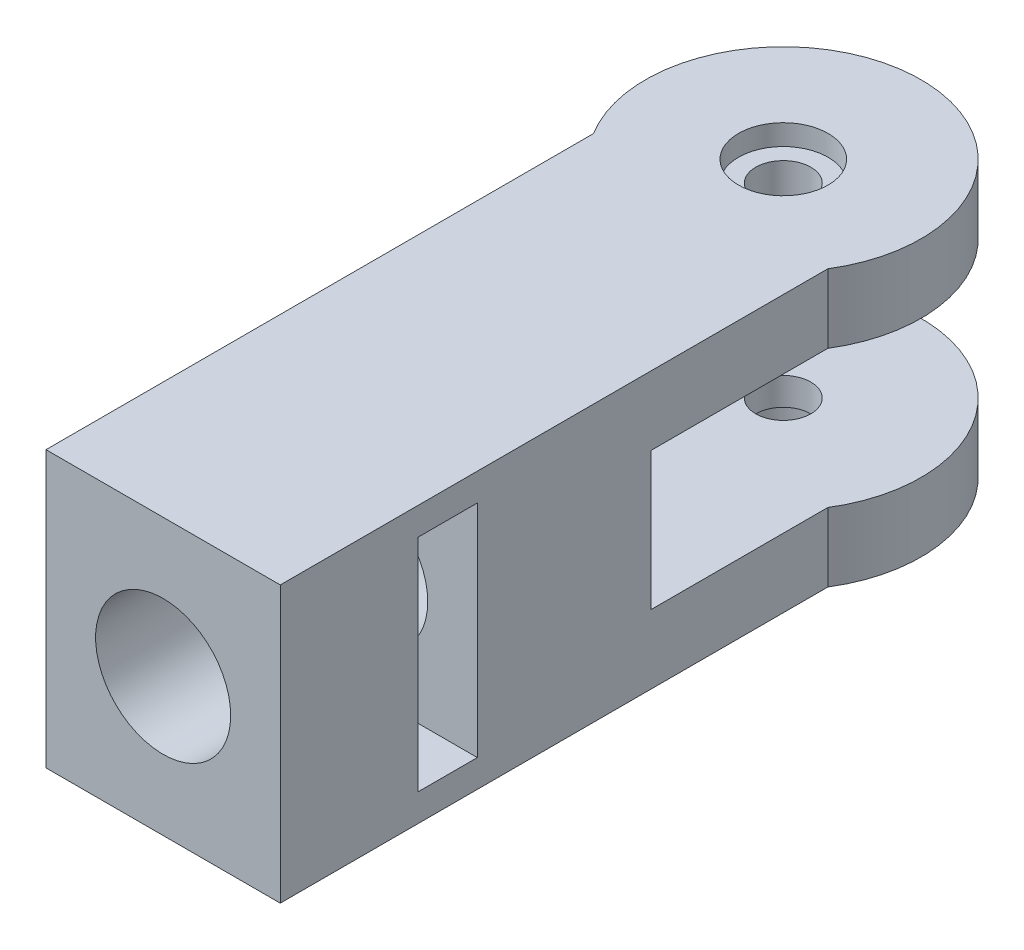
from build123d import *

# Parameters (mm, degrees)
SKETCH_1_W          = 17
SKETCH_1_H          = 20
EXTRUDE_1_DEPTH     = 40
SKETCH_3_R          = 10
SKETCH_3_R_2        = 2
EXTRUDE_2_DEPTH     = 10
EXTRUDE_START       = -5
SKETCH_4_R          = 10
SKETCH_4_R_2        = 2
EXTRUDE_3_DEPTH     = 5
SKETCH_5_R          = 20
CUT_EXTRUDE_1_DEPTH = 10
CUT_EXTRUDE_2_REACH = 66.858
SKETCH_6_R          = 4.9
CUT_EXTRUDE_3_REACH = 53.865
SKETCH_7_W          = 4.3
SKETCH_7_H          = 16
SKETCH_8_R          = 3.25
CUT_EXTRUDE_4_DEPTH = 3
CUT_EXTRUDE_START   = -1.5
SKETCH_9_R          = 3.25
CUT_EXTRUDE_5_DEPTH = 1.5


with BuildPart() as part:
    # 草图1 → 凸台-拉伸1 (new body)
    with BuildSketch(Plane.XY):
        with Locations((-10.828446216, -17.343796091)):
            Rectangle(SKETCH_1_W, SKETCH_1_H)
    extrude(amount=EXTRUDE_1_DEPTH)

    # 草图3 → 凸台-拉伸2 (add)
    with BuildSketch(Plane.XZ.offset(27.343796091)):
        with Locations((-10.828446216, -5)):
            Circle(SKETCH_3_R)
        with Locations((-10.828446216, -5)):
            Circle(SKETCH_3_R_2, mode=Mode.SUBTRACT)
    extrude(amount=-EXTRUDE_2_DEPTH)

    # 草图4 → 凸台-拉伸3 (add)
    with BuildSketch(Plane(origin=(0, -7.343796091, 0), x_dir=(1, 0, 0), z_dir=(0, 1, 0)).offset(EXTRUDE_START)):
        with Locations((-10.828446216, 5)):
            Circle(SKETCH_4_R)
        with Locations((-10.828446216, 5)):
            Circle(SKETCH_4_R_2, mode=Mode.SUBTRACT)
    extrude(amount=EXTRUDE_3_DEPTH)

    # 草图5 → 切除-拉伸1 (cut)
    with BuildSketch(Plane.XZ.offset(12.343796091)):
        with Locations((-10.828446216, -5)):
            Circle(SKETCH_5_R)
    extrude(amount=CUT_EXTRUDE_1_DEPTH, mode=Mode.SUBTRACT)

    # 草图6 → 切除-拉伸2 (cut, up to next)
    with BuildSketch(Plane.XY.offset(40), mode=Mode.PRIVATE) as cut_extrude_2_sk1:
        with Locations((-10.828446216, -17.343796091)):
            Circle(SKETCH_6_R)
    cut_extrude_2_tool1 = extrude(cut_extrude_2_sk1.sketch, amount=-CUT_EXTRUDE_2_REACH, mode=Mode.PRIVATE) & part.part
    add(cut_extrude_2_tool1.solids().sort_by_distance((-10.828446, -17.343796, 40))[0], mode=Mode.SUBTRACT)

    # 草图7 → 切除-拉伸3 (cut, up to next)
    with BuildSketch(Plane(origin=(-2.328446216, 0, 0), x_dir=(0, 0, -1), z_dir=(1, 0, 0)), mode=Mode.PRIVATE) as cut_extrude_3_sk1:
        with Locations((-27.85, -17.343796091)):
            Rectangle(SKETCH_7_W, SKETCH_7_H)
    cut_extrude_3_tool1 = extrude(cut_extrude_3_sk1.sketch, amount=-CUT_EXTRUDE_3_REACH, mode=Mode.PRIVATE) & part.part
    add(cut_extrude_3_tool1.solids().sort_by_distance((-2.328446, -17.343796, 27.85))[0], mode=Mode.SUBTRACT)

    # 草图8 → 切除-拉伸4 (cut)
    with BuildSketch(Plane.XZ.offset(27.343796091)):
        with Locations((-10.828446216, -5)):
            Circle(SKETCH_8_R)
    extrude(amount=-CUT_EXTRUDE_4_DEPTH, mode=Mode.SUBTRACT)

    # 草图9 → 切除-拉伸5 (cut)
    with BuildSketch(Plane(origin=(0, -7.343796091, 0), x_dir=(1, 0, 0), z_dir=(0, 1, 0)).offset(CUT_EXTRUDE_START)):
        with Locations((-10.828446216, 5)):
            Circle(SKETCH_9_R)
    extrude(amount=CUT_EXTRUDE_5_DEPTH, mode=Mode.SUBTRACT)


solid = part.part
